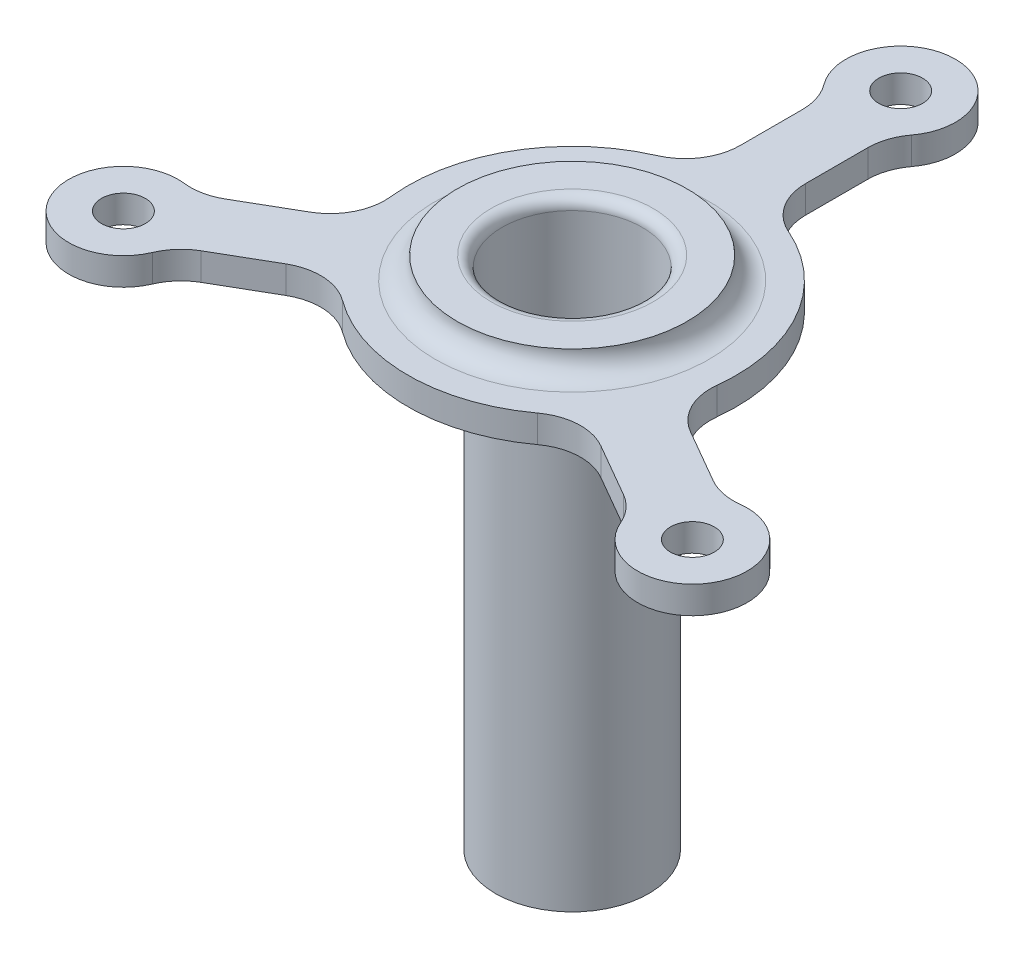
from build123d import *

# Parameters (mm, degrees)
SKETCH_1_R          = 2
SKETCH_1_R_2        = 6.4
EXTRUDE_1_DEPTH     = 2.5
EXTRUDE_START       = 2
SKETCH_2_R          = 10.5
SKETCH_2_R_2        = 6.4
EXTRUDE_2_DEPTH     = 2
SKETCH_3_R          = 11
CUT_EXTRUDE_1_DEPTH = 1
SKETCH_4_R          = 7
SKETCH_4_R_2        = 6.4
EXTRUDE_3_DEPTH     = 42
FILLET_2_R          = 1
SKETCH_5_R          = 7
SKETCH_5_R_2        = 4
EXTRUDE_4_DEPTH     = 1.5
FILLET_3_R          = 5
FILLET_4_R          = 2


with BuildPart() as part:
    # 草图1 → 凸台-拉伸1 (new body)
    with BuildSketch(Plane(origin=(0, 0, 0), x_dir=(1, 0, 0), z_dir=(0, 1, 0))):
        with BuildLine():
            ThreePointArc((3, 26), (0, 35), (-3, 26))
            Line((-3, 26), (-3, 14.696938457))
            ThreePointArc((-3, 14.696938457), (-12.990381057, 7.5), (-14.227922061, -4.750393017))
            Line((-14.227922061, -4.750393017), (-24.016660498, -10.401923789))
            ThreePointArc((-24.016660498, -10.401923789), (-30.310889132, -17.5), (-21.016660498, -15.598076211))
            Line((-21.016660498, -15.598076211), (-11.227922061, -9.94654544))
            ThreePointArc((-11.227922061, -9.94654544), (0, -15), (11.227922061, -9.94654544))
            Line((11.227922061, -9.94654544), (21.016660498, -15.598076211))
            ThreePointArc((21.016660498, -15.598076211), (30.310889132, -17.5), (24.016660498, -10.401923789))
            Line((24.016660498, -10.401923789), (14.227922061, -4.750393017))
            ThreePointArc((14.227922061, -4.750393017), (12.990381057, 7.5), (3, 14.696938457))
            Line((3, 14.696938457), (3, 26))
        make_face()
        with Locations(Location((-25.980762114, -15, 0), (0, 0, 270))):
            Circle(SKETCH_1_R, mode=Mode.SUBTRACT)
        with Locations(Location((0, 0, 0), (0, 0, 270))):
            Circle(SKETCH_1_R_2, mode=Mode.SUBTRACT)
        with Locations(Location((0, 30, 0), (0, 0, 270))):
            Circle(SKETCH_1_R, mode=Mode.SUBTRACT)
        with Locations(Location((25.980762114, -15, 0), (0, 0, 270))):
            Circle(SKETCH_1_R, mode=Mode.SUBTRACT)
    extrude(amount=-EXTRUDE_1_DEPTH)

    # 草图2 → 凸台-拉伸2 (add)
    with BuildSketch(Plane(origin=(0, 0, 0), x_dir=(1, 0, 0), z_dir=(0, 1, 0)).offset(EXTRUDE_START)):
        with Locations(Location((0, 0, 0), (0, 0, 270))):
            Circle(SKETCH_2_R)
        with Locations(Location((0, 0, 0), (0, 0, 270))):
            Circle(SKETCH_2_R_2, mode=Mode.SUBTRACT)
    extrude(amount=-EXTRUDE_2_DEPTH)

    # 草图3 → 切除-拉伸1 (cut)
    with BuildSketch(Plane.XZ.offset(2.5)):
        with Locations(Location((0, 0, 0), (0, 0, 270))):
            Circle(SKETCH_3_R)
    extrude(amount=-CUT_EXTRUDE_1_DEPTH, mode=Mode.SUBTRACT)

    # 草图4 → 凸台-拉伸3 (add)
    with BuildSketch(Plane.XZ.offset(1.5)):
        with Locations(Location((0, 0, 0), (0, 0, 90))):
            Circle(SKETCH_4_R)
        with Locations(Location((0, 0, 0), (0, 0, 90))):
            Circle(SKETCH_4_R_2, mode=Mode.SUBTRACT)
    extrude(amount=EXTRUDE_3_DEPTH)

    # 圆角2
    fillet_2_edges = [part.edges().sort_by_distance(p)[0] for p in [
        (0, 2, -6.4),
        (0, -1.5, -7),
    ]]
    fillet(fillet_2_edges, radius=FILLET_2_R)

    # 草图5 → 凸台-拉伸4 (add)
    with BuildSketch(Plane.XZ.offset(43.5)):
        with Locations(Location((0, 0, 0), (0, 0, 90))):
            Circle(SKETCH_5_R)
        with Locations(Location((0, 0, 0), (0, 0, 270))):
            Circle(SKETCH_5_R_2, mode=Mode.SUBTRACT)
    extrude(amount=EXTRUDE_4_DEPTH)

    # 圆角3
    fillet_3_edges = [part.edges().sort_by_distance(p)[0] for p in [
        (-24.016660498, -1.25, 10.401923789),
        (-14.227922061, -1.25, 4.750393017),
        (-3, -1.25, -14.696938457),
        (-3, -1.25, -26),
        (3, -1.25, -26),
        (3, -1.25, -14.696938457),
        (14.227922061, -1.25, 4.750393017),
        (24.016660498, -1.25, 10.401923789),
        (21.016660498, -1.25, 15.598076211),
        (11.227922061, -1.25, 9.94654544),
        (-11.227922061, -1.25, 9.94654544),
        (-21.016660498, -1.25, 15.598076211),
    ]]
    fillet(fillet_3_edges, radius=FILLET_3_R)

    # 圆角4
    fillet_4_edges = [part.edges().sort_by_distance(p)[0] for p in [
        (0, 0, -10.5),
    ]]
    fillet(fillet_4_edges, radius=FILLET_4_R - 0.0001)  # a hair under: the kernel refuses the full size


solid = part.part
